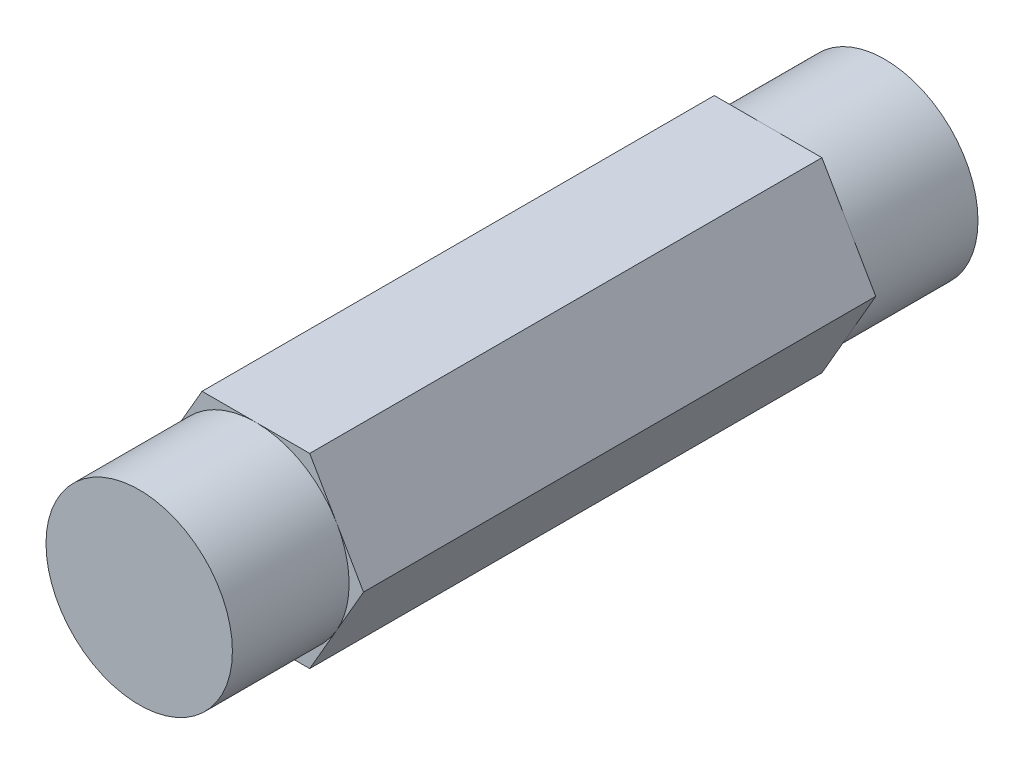
from build123d import *

# Parameters (mm, degrees)
BOSS_EXTRUDE1_DEPTH = 25.4
SKETCH3_OUTSIDE_W   = 27.54
SKETCH3_OUTSIDE_H   = 25.576
SKETCH3_OUTSIDE_R   = 6.35
CUT_EXTRUDE2_DEPTH  = 7.9502


with BuildPart() as part:
    # Sketch1 → Boss-Extrude1 (new, symmetric)
    with BuildSketch(Plane.XY):
        Polygon((7.332348419, 0), (3.666174209, 6.35), (-3.666174209, 6.35), (-7.332348419, 0), (-3.666174209, -6.35), (3.666174209, -6.35), align=None)
    extrude(amount=BOSS_EXTRUDE1_DEPTH, both=True)

    # Sketch3 outside → Cut-Extrude2 (cut)
    with BuildSketch(Plane.XY.offset(25.4)):
        Rectangle(SKETCH3_OUTSIDE_W, SKETCH3_OUTSIDE_H)
        Circle(SKETCH3_OUTSIDE_R, mode=Mode.SUBTRACT)
    cut_extrude2 = extrude(amount=-CUT_EXTRUDE2_DEPTH, mode=Mode.SUBTRACT)

    # Mirror1: Cut-Extrude2 across plane
    add(cut_extrude2.mirror(Plane.XY), mode=Mode.SUBTRACT)


solid = part.part
